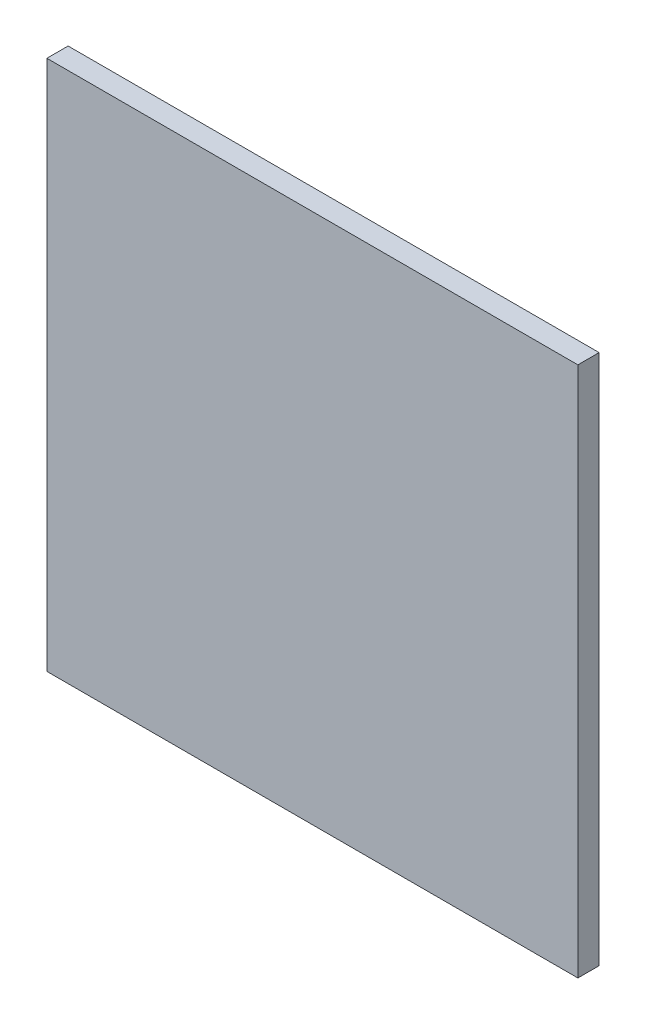
from build123d import *

# Parameters (mm, degrees)
SKIZZE2_W                       = 125
SKIZZE2_H                       = 125
AUFSATZ_LINEAR_AUSTRAGEN1_DEPTH = 5


with BuildPart() as part:
    # Skizze2 → Aufsatz-Linear austragen1 (new body)
    with BuildSketch(Plane.XY):
        Rectangle(SKIZZE2_W, SKIZZE2_H)
    extrude(amount=AUFSATZ_LINEAR_AUSTRAGEN1_DEPTH)


solid = part.part
